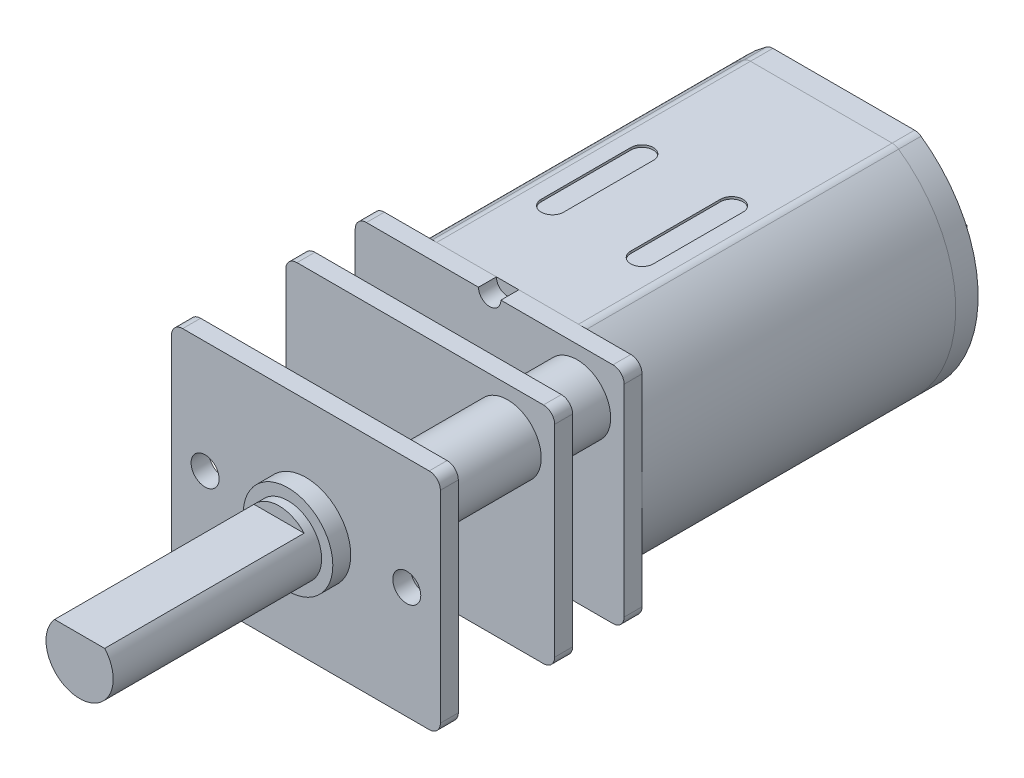
from build123d import *

# Parameters (mm, degrees)
BASE_FLANGE1_DEPTH           = 0.8
BOSS_EXTRUDE1_DEPTH          = 14
BOSS_EXTRUDE2_DEPTH          = 1
SKETCH8_R                    = 2.5
BOSS_EXTRUDE3_DEPTH          = 1
SKETCH9_R                    = 1
CUT_EXTRUDE1_DEPTH           = 0.5
SKETCH10_R                   = 0.45
BASE_FLANGE2_DEPTH           = 0.3
BASE_FLANGE3_START           = 0.8
BASE_FLANGE3_DEPTH           = 0.8
BASE_FLANGE4_DEPTH           = 0.8
SKETCH21_R                   = 1.5
BOSS_EXTRUDE4_DEPTH          = 2.3
BOSS_EXTRUDE4_2_DEPTH        = 2.3
SKETCH25_R                   = 1.5
BOSS_EXTRUDE5_DEPTH          = 4.3
BOSS_EXTRUDE5_2_DEPTH        = 4.3
SKETCH26_R                   = 2
BOSS_EXTRUDE6_DEPTH          = 0.8
SKETCH28_R                   = 1.5
BOSS_EXTRUDE7_DEPTH          = 9.3
CUT_EXTRUDE2_DEPTH           = 21.635164162
CUT_EXTRUDE2_DEPTH_BACK      = 21.635164162
SKETCH29_W                   = 8.9
SKETCH29_H                   = 0.5
M1_6_TAPPED_HOLE1_AT_2_COUNT = 2
M1_6_TAPPED_HOLE1_AT_2_PITCH = 9
SKETCH33_R                   = 0.5
CUT_EXTRUDE3_DEPTH           = 0.8
CUT_EXTRUDE4_DEPTH           = 0.1


# Sheet-metal steps are written as plain solids
with BuildPart() as part:
    # Sketch1 → Base-Flange1 (new body)
    with BuildSketch(Plane.XY):
        with BuildLine():
            Line((-5.5, -5), (5.5, -5))
            ThreePointArc((5.5, -5), (5.853553391, -4.853553391), (6, -4.5))
            Line((6, -4.5), (6, 4.5))
            ThreePointArc((6, 4.5), (5.853553391, 4.853553391), (5.5, 5))
            Line((5.5, 5), (-5.5, 5))
            ThreePointArc((-5.5, 5), (-5.853553391, 4.853553391), (-6, 4.5))
            Line((-6, 4.5), (-6, -4.5))
            ThreePointArc((-6, -4.5), (-5.853553391, -4.853553391), (-5.5, -5))
        make_face()
    extrude(amount=BASE_FLANGE1_DEPTH)

    # Sketch33 → Cut-Extrude3 (cut)
    with BuildSketch(Plane.XY.offset(0.8)):
        with Locations((0, 5)):
            Circle(SKETCH33_R)
    extrude(amount=-CUT_EXTRUDE3_DEPTH, mode=Mode.SUBTRACT)


with BuildPart() as body_2:
    # Sketch6 → Boss-Extrude1 (new body)
    with BuildSketch(Plane(origin=(0, 0, 0), x_dir=(-1, 0, 0), z_dir=(0, 0, -1))):
        with BuildLine():
            Line((-3.16227766, 5), (3.16227766, 5))
            ThreePointArc((3.16227766, 5), (3.313033332, 4.976731295), (3.449757447, 4.909090909))
            ThreePointArc((3.449757447, 4.909090909), (6, 0), (3.449757447, -4.909090909))
            ThreePointArc((3.449757447, -4.909090909), (3.313033332, -4.976731295), (3.16227766, -5))
            Line((3.16227766, -5), (-3.16227766, -5))
            ThreePointArc((-3.16227766, -5), (-3.313033332, -4.976731295), (-3.449757447, -4.909090909))
            ThreePointArc((-3.449757447, -4.909090909), (-6, 0), (-3.449757447, 4.909090909))
            ThreePointArc((-3.449757447, 4.909090909), (-3.313033332, 4.976731295), (-3.16227766, 5))
        make_face()
    extrude(amount=BOSS_EXTRUDE1_DEPTH)

    # Sketch34 → Cut-Extrude4 (cut)
    with BuildSketch(Plane(origin=(0, 5, 0), x_dir=(1, 0, 0), z_dir=(0, 1, 0))):
        with BuildLine():
            Line((-2.5, 4), (-2.5, 8))
            ThreePointArc((-2.5, 8), (-2, 8.5), (-1.5, 8))
            Line((-1.5, 8), (-1.5, 4))
            ThreePointArc((-1.5, 4), (-2, 3.5), (-2.5, 4))
        make_face()
        with BuildLine():
            Line((2.5, 4), (2.5, 8))
            ThreePointArc((2.5, 8), (2, 8.5), (1.5, 8))
            Line((1.5, 8), (1.5, 4))
            ThreePointArc((1.5, 4), (2, 3.5), (2.5, 4))
        make_face()
    cut_extrude4 = extrude(amount=-CUT_EXTRUDE4_DEPTH, mode=Mode.SUBTRACT)

    # Mirror2: Cut-Extrude4 across plane
    add(cut_extrude4.mirror(Plane.ZX), mode=Mode.SUBTRACT)


with BuildPart() as body_3:
    # Sketch7 → Boss-Extrude2 (new body)
    with BuildSketch(Plane(origin=(0, 0, -14), x_dir=(-1, 0, 0), z_dir=(0, 0, -1))):
        with BuildLine():
            Line((3.16227766, 5), (-3.16227766, 5))
            ThreePointArc((-3.16227766, 5), (-3.313033332, 4.976731295), (-3.449757447, 4.909090909))
            ThreePointArc((-3.449757447, 4.909090909), (-6, 0), (-3.449757447, -4.909090909))
            ThreePointArc((-3.449757447, -4.909090909), (-3.313033332, -4.976731295), (-3.16227766, -5))
            Line((-3.16227766, -5), (3.16227766, -5))
            ThreePointArc((3.16227766, -5), (3.313033332, -4.976731295), (3.449757447, -4.909090909))
            ThreePointArc((3.449757447, -4.909090909), (6, 0), (3.449757447, 4.909090909))
            ThreePointArc((3.449757447, 4.909090909), (3.313033332, 4.976731295), (3.16227766, 5))
        make_face()
    extrude(amount=BOSS_EXTRUDE2_DEPTH)

    # Sketch8 → Boss-Extrude3 (add)
    with BuildSketch(Plane(origin=(0, 0, -15), x_dir=(-1, 0, 0), z_dir=(0, 0, -1))):
        Circle(SKETCH8_R)
    extrude(amount=BOSS_EXTRUDE3_DEPTH)

    # Sketch9 → Cut-Extrude1 (cut)
    with BuildSketch(Plane(origin=(0, 0, -16), x_dir=(-1, 0, 0), z_dir=(0, 0, -1))):
        Circle(SKETCH9_R)
    extrude(amount=-CUT_EXTRUDE1_DEPTH, mode=Mode.SUBTRACT)


with BuildPart() as body_4:
    # Sketch10 → Base-Flange2 (new body)
    with BuildSketch(Plane(origin=(3.7, 0, 0), x_dir=(0, 0, -1), z_dir=(1, 0, 0))):
        with BuildLine():
            Line((15, 0.8), (16.65, 0.8))
            ThreePointArc((16.65, 0.8), (16.756066017, 0.756066017), (16.8, 0.65))
            Line((16.8, 0.65), (16.8, -0.65))
            ThreePointArc((16.8, -0.65), (16.756066017, -0.756066017), (16.65, -0.8))
            Line((16.65, -0.8), (15, -0.8))
            Line((15, -0.8), (15, 0.8))
        make_face()
        with Locations((16, 0)):
            Circle(SKETCH10_R, mode=Mode.SUBTRACT)
    extrude(amount=-BASE_FLANGE2_DEPTH)


with BuildPart() as body_5:
    # Mirror1: mirrored copy
    add(body_4.part.mirror(Plane(origin=(0, 0, 0), x_dir=(0, 0, 1), z_dir=(1, 0, 0))))


with BuildPart() as body_6:
    # Sketch15 → Base-Flange3 (new body)
    with BuildSketch(Plane(origin=(0, 0, 9), x_dir=(-1, 0, 0), z_dir=(0, 0, -1)).offset(BASE_FLANGE3_START)):
        with BuildLine():
            Line((-5.5, -5), (5.5, -5))
            ThreePointArc((5.5, -5), (5.853553391, -4.853553391), (6, -4.5))
            Line((6, -4.5), (6, 4.5))
            ThreePointArc((6, 4.5), (5.853553391, 4.853553391), (5.5, 5))
            Line((5.5, 5), (-5.5, 5))
            ThreePointArc((-5.5, 5), (-5.853553391, 4.853553391), (-6, 4.5))
            Line((-6, 4.5), (-6, -4.5))
            ThreePointArc((-6, -4.5), (-5.853553391, -4.853553391), (-5.5, -5))
        make_face()
    extrude(amount=-BASE_FLANGE3_DEPTH)

    # Sketch26 → Boss-Extrude6 (add)
    with BuildSketch(Plane.XY.offset(9)):
        Circle(SKETCH26_R)
    extrude(amount=BOSS_EXTRUDE6_DEPTH)

    # Sketch32 → M1.6 Tapped Hole1 (revolve, cut)
    with BuildSketch(Plane(origin=(-4.5, 0, 9), x_dir=(0, -1, 0), z_dir=(1, 0, 0))):
        Polygon((0, 0), (0, 1.375537887), (0.625, 1), (0.625, 0), align=None)
    m1_6_tapped_hole1 = revolve(axis=Axis((-4.5, 0, 15.35), (0, 0, -1)), mode=Mode.SUBTRACT)

    # M1.6 Tapped Hole1 at 2: M1.6 Tapped Hole1 ×2
    with Locations(*[(i * M1_6_TAPPED_HOLE1_AT_2_PITCH, 0, 0) for i in range(1, M1_6_TAPPED_HOLE1_AT_2_COUNT)]):
        add(m1_6_tapped_hole1, mode=Mode.SUBTRACT)


with BuildPart() as body_7:
    # Sketch18 → Base-Flange4 (new body)
    with BuildSketch(Plane.XY.offset(3.1)):
        with BuildLine():
            Line((-5.5, -5), (5.5, -5))
            ThreePointArc((5.5, -5), (5.853553391, -4.853553391), (6, -4.5))
            Line((6, -4.5), (6, 4.5))
            ThreePointArc((6, 4.5), (5.853553391, 4.853553391), (5.5, 5))
            Line((5.5, 5), (-5.5, 5))
            ThreePointArc((-5.5, 5), (-5.853553391, 4.853553391), (-6, 4.5))
            Line((-6, 4.5), (-6, -4.5))
            ThreePointArc((-6, -4.5), (-5.853553391, -4.853553391), (-5.5, -5))
        make_face()
    extrude(amount=BASE_FLANGE4_DEPTH)


with BuildPart() as body_8:
    # Sketch21 → Boss-Extrude4 (new body)
    with BuildSketch(Plane.XY.offset(0.8)):
        with Locations((3.9, 2.9)):
            Circle(SKETCH21_R)
    extrude(amount=BOSS_EXTRUDE4_DEPTH)


with BuildPart() as body_9:
    # Sketch21 → Boss-Extrude4 2 (new body)
    with BuildSketch(Plane.XY.offset(0.8)):
        with Locations((-3.9, -2.9)):
            Circle(SKETCH21_R)
    extrude(amount=BOSS_EXTRUDE4_2_DEPTH)


with BuildPart() as body_10:
    # Sketch25 → Boss-Extrude5 (new body)
    with BuildSketch(Plane.XY.offset(3.9)):
        with Locations(Location((3.9, 2.9, 0), (0, 0, 180))):
            Circle(SKETCH25_R)
    extrude(amount=BOSS_EXTRUDE5_DEPTH)


with BuildPart() as body_11:
    # Sketch25 → Boss-Extrude5 2 (new body)
    with BuildSketch(Plane.XY.offset(3.9)):
        with Locations(Location((-3.9, -2.9, 0), (0, 0, 180))):
            Circle(SKETCH25_R)
    extrude(amount=BOSS_EXTRUDE5_2_DEPTH)


with BuildPart() as body_12:
    # Sketch28 → Boss-Extrude7 (new body)
    with BuildSketch(Plane.XY.offset(9.8)):
        Circle(SKETCH28_R)
    extrude(amount=BOSS_EXTRUDE7_DEPTH)

    # Sketch29 → Cut-Extrude2 (cut, two sides: drawn at the far end of the back side and taken through both)
    with BuildSketch(Plane(origin=(0, 0, 0), x_dir=(0, 0, -1), z_dir=(1, 0, 0)).offset(-CUT_EXTRUDE2_DEPTH_BACK)):
        with Locations((-14.65, 1.25)):
            Rectangle(SKETCH29_W, SKETCH29_H)
    extrude(amount=CUT_EXTRUDE2_DEPTH + CUT_EXTRUDE2_DEPTH_BACK, mode=Mode.SUBTRACT)


solid = Compound([part.part, body_2.part, body_3.part, body_4.part, body_5.part, body_6.part, body_7.part, body_8.part, body_9.part, body_10.part, body_11.part, body_12.part])
